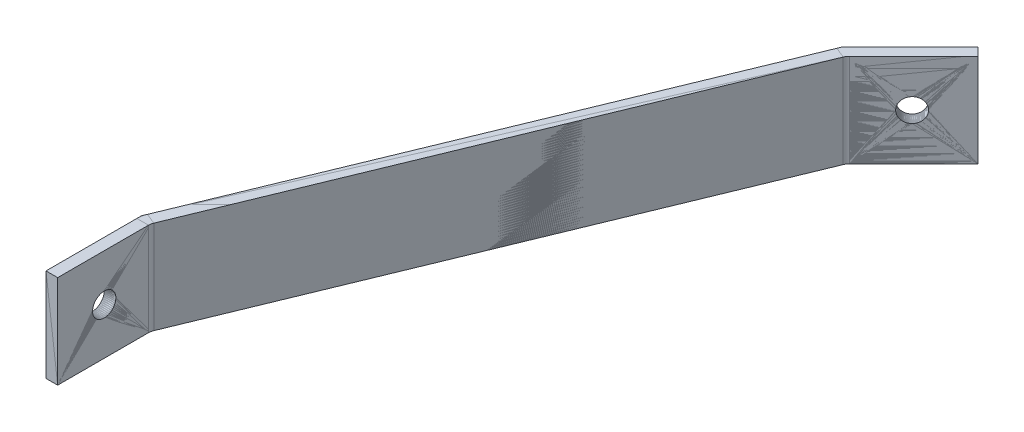
from build123d import *

# Parameters (mm, degrees)
EXTRUDE_THIN1_DEPTH    = 12.7
SKETCH3_R              = 3.175
CUT_EXTRUDE1_DEPTH     = 955.551399154
SKETCH2_R              = 3.175
CUT_EXTRUDE2_DEPTH     = 918.120523582
CONVERT_SOLID1_START   = 851.804423502
CONVERT_SOLID1_DEPTH   = 9.5249999
CONVERT_SOLID1_START_2 = 867.679423602
CONVERT_SOLID1_2_DEPTH = 9.5249999
CONVERT_SOLID1_START_3 = 861.329423402
CONVERT_SOLID1_3_DEPTH = 6.3500002


with BuildPart() as part:
    # Sketch1 → Extrude-Thin1 (new, symmetric)
    with BuildSketch(Plane(origin=(0, 864.504423502, 0), x_dir=(1, 0, 0), z_dir=(0, 1, 0))):
        Polygon((81.577207348, -190.852816746), (63.616695106, -208.813328988), (8.366428726, -343.172904376), (8.366428726, -368.572904376), (5.191428726, -368.572904376), (5.191428726, -342.545589137), (60.922066406, -207.017829627), (79.332143317, -188.607752715), align=None)
    extrude(amount=EXTRUDE_THIN1_DEPTH, both=True)

    # Sketch3 → Cut-Extrude1 (cut, through all)
    with BuildSketch(Plane.ZY.offset(-5.191428726)):
        with Locations((355.872904376, 864.504423502)):
            Circle(SKETCH3_R)
    extrude(amount=-CUT_EXTRUDE1_DEPTH, mode=Mode.SUBTRACT)

    # Sketch2 → Cut-Extrude2 (cut, through all)
    with BuildSketch(Plane(origin=(133.969948016, 0, 133.969948016), x_dir=(-0.7071067811865468, 0, 0.7071067811865483), z_dir=(-0.7071067811865483, 0, -0.7071067811865468))):
        with Locations((89.969524424, 864.504423502)):
            Circle(SKETCH2_R)
    extrude(amount=-CUT_EXTRUDE2_DEPTH, mode=Mode.SUBTRACT)


with BuildPart() as body_2:
    # Convert-Solid1: read off the stored shape, not the designer's step
    # Convert-Solid1 outline → Convert-Solid1 (new body)
    with BuildSketch(Plane(origin=(0, 0, 0), x_dir=(1, 0, 0), z_dir=(0, 1, 0)).offset(CONVERT_SOLID1_START)):
        with BuildLine():
            Line((81.577207348, -190.852816746), (79.332143317, -188.607752715))
            Line((79.332143317, -188.607752715), (61.821195745, -206.118700288))
            ThreePointArc((61.821195745, -206.118700288), (61.02697209, -207.087730942), (60.438475677, -208.19384287))
            Line((60.438475677, -208.19384287), (5.668580598, -341.385234136))
            ThreePointArc((5.668580598, -341.385234136), (5.311858692, -342.569383642), (5.191428726, -343.800219615))
            Line((5.191428726, -343.800219615), (5.191428726, -368.572904376))
            Line((5.191428726, -368.572904376), (8.366428726, -368.572904376))
            Line((8.366428726, -368.572904376), (8.366428726, -343.800219615))
            ThreePointArc((8.366428726, -343.800219615), (8.426643709, -343.184801628), (8.605004662, -342.592726875))
            Line((8.605004662, -342.592726875), (63.374899742, -209.401335609))
            ThreePointArc((63.374899742, -209.401335609), (63.669147948, -208.848279645), (64.066259775, -208.363764318))
            Line((64.066259775, -208.363764318), (81.577207348, -190.852816746))
        make_face()
    extrude(amount=CONVERT_SOLID1_DEPTH)

    # Convert-Solid1 2 outline → Convert-Solid1 2 (add)
    with BuildSketch(Plane(origin=(0, 0, 0), x_dir=(1, 0, 0), z_dir=(0, 1, 0)).offset(CONVERT_SOLID1_START_2)):
        with BuildLine():
            Line((81.577207348, -190.852816746), (79.332143317, -188.607752715))
            Line((79.332143317, -188.607752715), (61.821195745, -206.118700288))
            ThreePointArc((61.821195745, -206.118700288), (61.02697209, -207.087730942), (60.438475677, -208.19384287))
            Line((60.438475677, -208.19384287), (5.668580598, -341.385234136))
            ThreePointArc((5.668580598, -341.385234136), (5.311858692, -342.569383642), (5.191428726, -343.800219615))
            Line((5.191428726, -343.800219615), (5.191428726, -368.572904376))
            Line((5.191428726, -368.572904376), (8.366428726, -368.572904376))
            Line((8.366428726, -368.572904376), (8.366428726, -343.800219615))
            ThreePointArc((8.366428726, -343.800219615), (8.426643709, -343.184801628), (8.605004662, -342.592726875))
            Line((8.605004662, -342.592726875), (63.374899742, -209.401335609))
            ThreePointArc((63.374899742, -209.401335609), (63.669147948, -208.848279645), (64.066259775, -208.363764318))
            Line((64.066259775, -208.363764318), (81.577207348, -190.852816746))
        make_face()
    extrude(amount=CONVERT_SOLID1_2_DEPTH)

    # Convert-Solid1 3 outline → Convert-Solid1 3 (add)
    with BuildSketch(Plane(origin=(0, 0, 0), x_dir=(1, 0, 0), z_dir=(0, 1, 0)).offset(CONVERT_SOLID1_START_3)):
        with BuildLine():
            Line((81.577207348, -190.852816746), (79.332143317, -188.607752715))
            Line((79.332143317, -188.607752715), (61.821195745, -206.118700288))
            ThreePointArc((61.821195745, -206.118700288), (61.02697209, -207.087730942), (60.438475677, -208.19384287))
            Line((60.438475677, -208.19384287), (5.668580598, -341.385234136))
            ThreePointArc((5.668580598, -341.385234136), (5.311858692, -342.569383642), (5.191428726, -343.800219615))
            Line((5.191428726, -343.800219615), (5.191428726, -368.572904376))
            Line((5.191428726, -368.572904376), (8.366428726, -368.572904376))
            Line((8.366428726, -368.572904376), (8.366428726, -343.800219615))
            ThreePointArc((8.366428726, -343.800219615), (8.426643709, -343.184801628), (8.605004662, -342.592726875))
            Line((8.605004662, -342.592726875), (63.374899742, -209.401335609))
            ThreePointArc((63.374899742, -209.401335609), (63.669147948, -208.848279645), (64.066259775, -208.363764318))
            Line((64.066259775, -208.363764318), (81.577207348, -190.852816746))
        make_face()
    extrude(amount=CONVERT_SOLID1_3_DEPTH)

    # Convert-Solid1 4: loft between two sections, ruled curve by curve
    convert_solid1_4_from = [
        Edge.make_three_point_arc((72.596951227, 864.504423502, 195.342944806), (70.351887196, 867.679423502, 197.588008837), (68.106823166, 864.504423502, 199.833072867)),
        Edge.make_three_point_arc((68.106823166, 864.504423502, 199.833072867), (70.351887196, 861.329423502, 197.588008837), (72.596951227, 864.504423502, 195.342944806)),
    ]
    convert_solid1_4_to = [
        Edge.make_three_point_arc((74.842015257, 864.504423502, 197.588008837), (72.596951227, 867.679423502, 199.833072867), (70.351887196, 864.504423502, 202.078136897)),
        Edge.make_three_point_arc((70.351887196, 864.504423502, 202.078136897), (72.596951227, 861.329423502, 199.833072867), (74.842015257, 864.504423502, 197.588008837)),
    ]
    convert_solid1_4 = Solid(Shell([*[Face.make_surface_from_curves(convert_solid1_4_from[k], convert_solid1_4_to[k]) for k in range(2)], Face(Wire(convert_solid1_4_from)), Face(Wire(convert_solid1_4_to))]))
    add(convert_solid1_4, mode=Mode.SUBTRACT)

    # Convert-Solid1 5: loft between two sections, ruled curve by curve
    convert_solid1_5_from = [
        Edge.make_three_point_arc((5.191428726, 864.504423502, 352.697904376), (5.191428726, 867.679423502, 355.872904376), (5.191428726, 864.504423502, 359.047904376)),
        Edge.make_three_point_arc((5.191428726, 864.504423502, 359.047904376), (5.191428726, 861.329423502, 355.872904376), (5.191428726, 864.504423502, 352.697904376)),
    ]
    convert_solid1_5_to = [
        Edge.make_three_point_arc((8.366428726, 864.504423502, 352.697904376), (8.366428726, 867.679423502, 355.872904376), (8.366428726, 864.504423502, 359.047904376)),
        Edge.make_three_point_arc((8.366428726, 864.504423502, 359.047904376), (8.366428726, 861.329423502, 355.872904376), (8.366428726, 864.504423502, 352.697904376)),
    ]
    convert_solid1_5 = Solid(Shell([*[Face.make_surface_from_curves(convert_solid1_5_from[k], convert_solid1_5_to[k]) for k in range(2)], Face(Wire(convert_solid1_5_from)), Face(Wire(convert_solid1_5_to))]))
    add(convert_solid1_5, mode=Mode.SUBTRACT)


solid = Compound([part.part, body_2.part])
